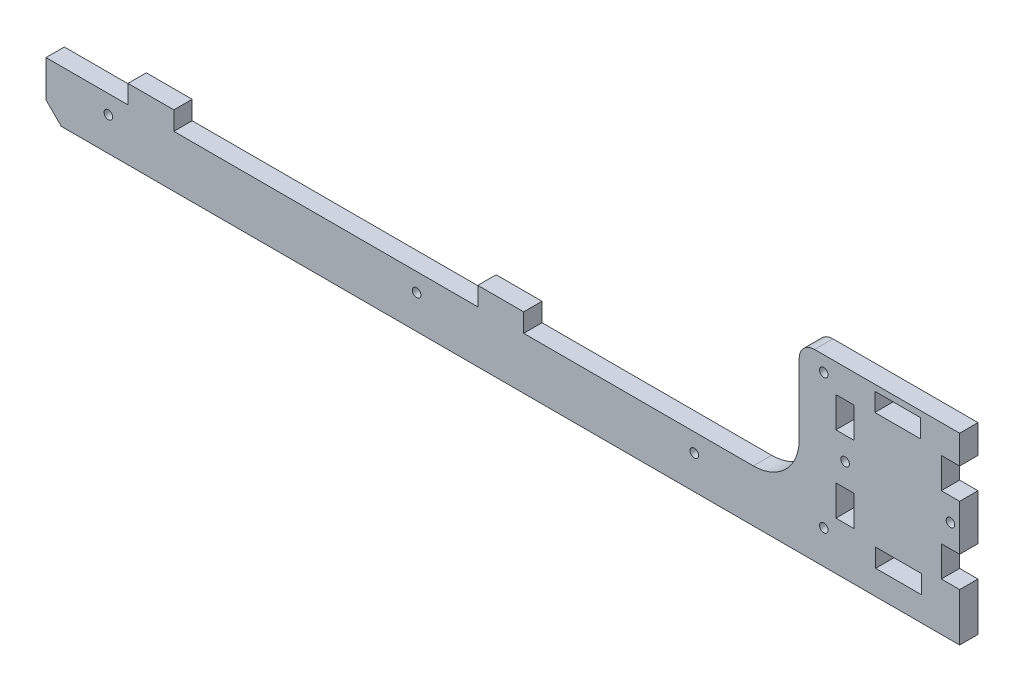
from build123d import *

# Parameters (mm, degrees)
SKETCH_1_R      = 1.4
SKETCH_1_W      = 15
SKETCH_1_H      = 6
SKETCH_1_W_2    = 6
SKETCH_1_H_2    = 10
EXTRUDE_1_DEPTH = 6


with BuildPart() as part:
    # Эскиз1 → Бобышка-Вытянуть1 (new body)
    with BuildSketch(Plane.XY):
        with BuildLine():
            Line((96.920798757, 2), (96.920798757, 25))
            ThreePointArc((96.920798757, 25), (98.385264851, 28.535533906), (101.920798757, 30))
            Line((101.920798757, 30), (149.389201243, 30))
            Line((149.389201243, 30), (149.389201243, 20.709265489))
            Line((149.389201243, 20.709265489), (143.389201243, 20.709265489))
            Line((143.389201243, 20.709265489), (143.389201243, 10.709265489))
            Line((143.389201243, 10.709265489), (149.389201243, 10.709265489))
            Line((149.389201243, 10.709265489), (149.389201243, -4.290734511))
            Line((149.389201243, -4.290734511), (143.389201243, -4.290734511))
            Line((143.389201243, -4.290734511), (143.389201243, -14.290734511))
            Line((143.389201243, -14.290734511), (149.389201243, -14.290734511))
            Line((149.389201243, -14.290734511), (149.389201243, -30))
            Line((149.389201243, -30), (-144.389201243, -30))
            Line((-144.389201243, -30), (-149.389201243, -25))
            Line((-149.389201243, -25), (-149.389201243, -13))
            Line((-149.389201243, -13), (-122.58858016, -13))
            Line((-122.58858016, -13), (-122.58858016, -6.916819089))
            Line((-122.58858016, -6.916819089), (-107.58858016, -6.916819089))
            Line((-107.58858016, -6.916819089), (-107.58858016, -13))
            Line((-107.58858016, -13), (-10.160618924, -13))
            Line((-10.160618924, -13), (-8.18858016, -13))
            Line((-8.18858016, -13), (-8.18858016, -6.916819089))
            Line((-8.18858016, -6.916819089), (6.81141984, -6.916819089))
            Line((6.81141984, -6.916819089), (6.81141984, -13))
            Line((6.81141984, -13), (81.920798757, -13))
            ThreePointArc((81.920798757, -13), (92.527400475, -8.606601718), (96.920798757, 2))
        make_face()
        with Locations((104.970798757, -19)):
            Circle(SKETCH_1_R, mode=Mode.SUBTRACT)
        with Locations((104.970798757, 25)):
            Circle(SKETCH_1_R, mode=Mode.SUBTRACT)
        with Locations((111.920798757, 3.209265489)):
            Circle(SKETCH_1_R, mode=Mode.SUBTRACT)
        with Locations((146.389201243, 3.209265489)):
            Circle(SKETCH_1_R, mode=Mode.SUBTRACT)
        with Locations((-128.98858016, -19)):
            Circle(SKETCH_1_R, mode=Mode.SUBTRACT)
        with Locations((-28.18858016, -19)):
            Circle(SKETCH_1_R, mode=Mode.SUBTRACT)
        with Locations((62.61141984, -19)):
            Circle(SKETCH_1_R, mode=Mode.SUBTRACT)
        with Locations((129.420798757, -19)):
            Rectangle(SKETCH_1_W, SKETCH_1_H, mode=Mode.SUBTRACT)
        with Locations((111.920798757, 15.709265489)):
            Rectangle(SKETCH_1_W_2, SKETCH_1_H_2, mode=Mode.SUBTRACT)
        with Locations((111.920798757, -9.290734511)):
            Rectangle(SKETCH_1_W_2, SKETCH_1_H_2, mode=Mode.SUBTRACT)
        with Locations((129.155798757, 25)):
            Rectangle(SKETCH_1_W, SKETCH_1_H, mode=Mode.SUBTRACT)
    extrude(amount=EXTRUDE_1_DEPTH)


solid = part.part
